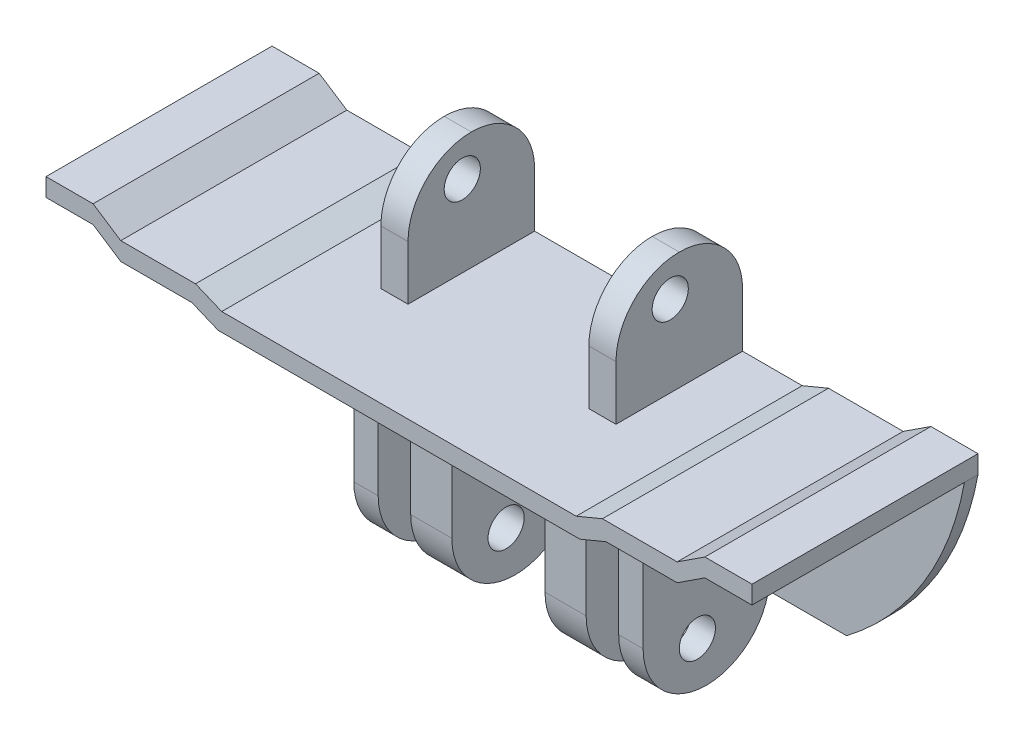
from build123d import *

# Parameters (mm, degrees)
SKETCH2_W                 = 5
SKETCH2_H                 = 25
BOSS_EXTRUDE1_DEPTH       = 14
BOSS_EXTRUDE1_2_DEPTH     = 14
BOSS_EXTRUDE3_DEPTH       = 25
SKETCH5_W                 = 3
SKETCH5_H                 = 13
BOSS_EXTRUDE4_DEPTH       = 14
SKETCH7_W                 = 3
SKETCH7_H                 = 25
BOSS_EXTRUDE5_DEPTH       = 14
SKETCH15_W                = 0.3
SKETCH15_H                = 14
CUT_EXTRUDE2_DEPTH        = 25
SKETCH16_W                = 0.15
SKETCH16_H                = 14
CUT_EXTRUDE3_DEPTH        = 25
FILLET1_R                 = 7
F_4_0MM_DOWEL_HOLE2_D     = 4
FILLET2_R                 = 7
F_4_0MM_DOWEL_HOLE1_D     = 4
F_4_0MM_DOWEL_HOLE1_DEPTH = 26
F_4_0MM_DOWEL_HOLE1_TIP   = 1.201721238
BOSS_EXTRUDE6_DEPTH       = 1.5


with BuildPart() as part:
    # Sketch2 → Boss-Extrude1 (new body)
    with BuildSketch(Plane.XY):
        with Locations((-7.5, -6.5)):
            Rectangle(SKETCH2_W, SKETCH2_H)
    extrude(amount=BOSS_EXTRUDE1_DEPTH)



with BuildPart() as body_2:
    # Sketch2 → Boss-Extrude1 2 (new body)
    with BuildSketch(Plane.XY):
        with Locations((7.5, -6.5)):
            Rectangle(SKETCH2_W, SKETCH2_H)
    extrude(amount=BOSS_EXTRUDE1_2_DEPTH)


with BuildPart() as part_1:
    add(part.part)

    add(body_2.part)  # Boss-Extrude3 merges body 2
    # Sketch4 → Boss-Extrude3 (add)
    with BuildSketch(Plane.XY):
        Polygon((-26, 9.206366686), (-30.765993712, 9.206366686), (-33.831204342, 11.206366686), (-39.037863495, 11.206366686), (-39.037863495, 9.206366686), (-33.831204342, 9.206366686), (-30.765993712, 7.206366686), (-26, 7.206366686), align=None)
        Polygon((22.901603942, 7.206366686), (26, 7.206366686), (26, 9.206366686), (22.502408858, 9.206366686), (19.600804916, 8), (10, 8), (-10, 8), (-19.600804916, 8), (-22.502408858, 9.206366686), (-26, 9.206366686), (-26, 7.206366686), (-22.901603942, 7.206366686), (-20, 6), (-10, 6), (10, 6), (20, 6), align=None)
        Polygon((26, 7.206366686), (26, 9.206366686), (30.765993712, 9.206366686), (33.831204342, 11.206366686), (39.037863495, 11.206366686), (39.037863495, 9.206366686), (33.831204342, 9.206366686), (30.765993712, 7.206366686), align=None)
    extrude(amount=BOSS_EXTRUDE3_DEPTH)

    # Sketch5 → Boss-Extrude4 (add)
    with BuildSketch(Plane.XY):
        with Locations((-11.5, 14.5)):
            Rectangle(SKETCH5_W, SKETCH5_H)
        with Locations((11.5, 14.5)):
            Rectangle(SKETCH5_W, SKETCH5_H)
    extrude(amount=BOSS_EXTRUDE4_DEPTH)

    # Sketch7 → Boss-Extrude5 (add)
    with BuildSketch(Plane.XY):
        with Locations((-14.5, -6.5)):
            Rectangle(SKETCH7_W, SKETCH7_H)
        with Locations((14.5, -6.5)):
            Rectangle(SKETCH7_W, SKETCH7_H)
    extrude(amount=BOSS_EXTRUDE5_DEPTH)

    # Sketch15 → Cut-Extrude2 (cut)
    with BuildSketch(Plane.XZ.offset(19)):
        with Locations((-9.85, 7)):
            Rectangle(SKETCH15_W, SKETCH15_H)
        with Locations((9.85, 7)):
            Rectangle(SKETCH15_W, SKETCH15_H)
        with Locations((-13.15, 7)):
            Rectangle(SKETCH15_W, SKETCH15_H)
        with Locations((13.15, 7)):
            Rectangle(SKETCH15_W, SKETCH15_H)
    extrude(amount=-CUT_EXTRUDE2_DEPTH, mode=Mode.SUBTRACT)

    # Sketch16 → Cut-Extrude3 (cut)
    with BuildSketch(Plane.XZ.offset(19)):
        with Locations((-5.075, 7)):
            Rectangle(SKETCH16_W, SKETCH16_H)
        with Locations((5.075, 7)):
            Rectangle(SKETCH16_W, SKETCH16_H)
    extrude(amount=-CUT_EXTRUDE3_DEPTH, mode=Mode.SUBTRACT)

    # Fillet1
    fillet1_edges = [part_1.edges().sort_by_distance(p)[0] for p in [
        (7.425, -19, 0),
        (7.425, -19, 14),
        (-7.425, -19, 0),
        (-7.425, -19, 14),
        (-14.65, -19, 0),
        (-14.65, -19, 14),
        (14.65, -19, 14),
        (14.65, -19, 0),
    ]]
    fillet(fillet1_edges, radius=FILLET1_R - 0.0001)  # a hair under: the kernel refuses the full size

    # Ø4.0mm Dowel Hole2 (through all)
    with Locations(Plane(origin=(16, 0, 0), x_dir=(0, 0, -1), z_dir=(1, 0, 0))):
        with Locations((-8, -14)):
            Hole(F_4_0MM_DOWEL_HOLE2_D / 2)

    # Fillet2
    fillet2_edges = [part_1.edges().sort_by_distance(p)[0] for p in [
        (-11.5, 21, 0),
        (-11.5, 21, 14),
        (11.5, 21, 0),
        (11.5, 21, 14),
    ]]
    fillet(fillet2_edges, radius=FILLET2_R - 0.0001)  # a hair under: the kernel refuses the full size

    # Ø4.0mm Dowel Hole1
    with Locations(Plane(origin=(13, 0, 0), x_dir=(0, 0, -1), z_dir=(1, 0, 0))):
        with Locations((-8, 17)):
            Hole(F_4_0MM_DOWEL_HOLE1_D / 2, depth=F_4_0MM_DOWEL_HOLE1_DEPTH)
            with Locations((0, 0, -(F_4_0MM_DOWEL_HOLE1_DEPTH + F_4_0MM_DOWEL_HOLE1_TIP / 2))):  # 118° drill point
                Cone(0, F_4_0MM_DOWEL_HOLE1_D / 2, F_4_0MM_DOWEL_HOLE1_TIP, mode=Mode.SUBTRACT)

    # Sketch14 → Boss-Extrude6 (add)
    with BuildSketch(Plane.XY):
        with BuildLine():
            Line((-22.901603942, 7.206366686), (-30.765993712, 7.206366686))
            Line((-30.765993712, 7.206366686), (-33.831204342, 9.206366686))
            Line((-33.831204342, 9.206366686), (-39.037863495, 9.206366686))
            ThreePointArc((-39.037863495, 9.206366686), (-34.518223809, -2.625999259), (-26, -12))
            Line((-26, -12), (-16, -12))
            Line((-16, -12), (-16, 6))
            Line((-16, 6), (-20, 6))
            Line((-20, 6), (-22.901603942, 7.206366686))
        make_face()
        with BuildLine():
            Line((20, 6), (16, 6))
            Line((16, 6), (16, -12))
            Line((16, -12), (26, -12))
            ThreePointArc((26, -12), (34.518223809, -2.625999259), (39.037863495, 9.206366686))
            Line((39.037863495, 9.206366686), (33.831204342, 9.206366686))
            Line((33.831204342, 9.206366686), (30.765993712, 7.206366686))
            Line((30.765993712, 7.206366686), (22.901603942, 7.206366686))
            Line((22.901603942, 7.206366686), (20, 6))
        make_face()
    extrude(amount=BOSS_EXTRUDE6_DEPTH)


solid = part_1.part
